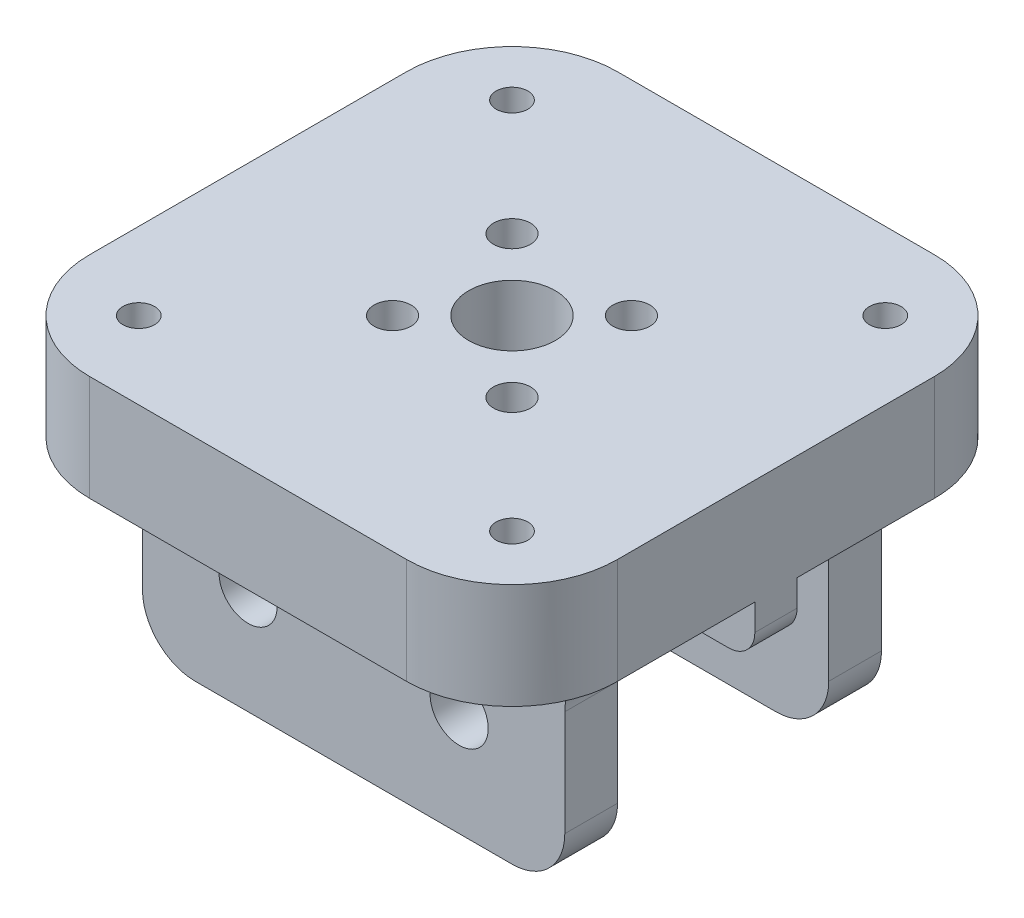
from build123d import *
from build123d.topology import SkipClean

# Parameters (mm, degrees)
SKETCH1_W                       = 50
SKETCH1_H                       = 50
BOSS_EXTRUDE1_DEPTH             = 5
BOSS_EXTRUDE3_START             = -25
SKETCH4_W                       = 4
SKETCH4_H                       = 5
BOSS_EXTRUDE3_DEPTH             = 50
CBORE_FOR_M3_SBHCS1_D           = 3.5
CBORE_FOR_M3_SBHCS1_DEPTH       = 10.76
CBORE_FOR_M3_SBHCS1_CBORE_D     = 6.7
CBORE_FOR_M3_SBHCS1_CBORE_DEPTH = 1.65
CBORE_FOR_M3_SBHCS1_TIP         = 1.051506083
CBORE_FOR_M3_SBHCS2_D           = 3
CBORE_FOR_M3_SBHCS2_DEPTH       = 10.76
CBORE_FOR_M3_SBHCS2_CBORE_D     = 6.7
CBORE_FOR_M3_SBHCS2_CBORE_DEPTH = 1.65
CBORE_FOR_M3_SBHCS2_TIP         = 0.901290929
SKETCH19_W                      = 5
SKETCH19_H                      = 20
BOSS_EXTRUDE4_DEPTH             = 20
M5_CLEARANCE_HOLE1_D            = 5.5
FILLET1_R                       = 10
FILLET2_R                       = 5
FILLET3_R                       = 5
FILLET4_R                       = 2.5
FILLET5_R                       = 2.5
SKETCH24_R                      = 4.1
CUT_EXTRUDE1_DEPTH              = 8


# Some blends are built 0.0001 mm under size
with BuildPart() as part:
    # Sketch1 → Boss-Extrude1 (new, symmetric)
    with BuildSketch(Plane(origin=(0, 0, 0), x_dir=(1, 0, 0), z_dir=(0, 1, 0))):
        Rectangle(SKETCH1_W, SKETCH1_H)
    extrude(amount=BOSS_EXTRUDE1_DEPTH, both=True)

    # Sketch4 → Boss-Extrude3 (add)
    with BuildSketch(Plane(origin=(0, 0, 0), x_dir=(0, 0, -1), z_dir=(1, 0, 0)).offset(BOSS_EXTRUDE3_START)):
        with Locations((0, -7.5)):
            Rectangle(SKETCH4_W, SKETCH4_H)
    extrude(amount=BOSS_EXTRUDE3_DEPTH)

    # CBORE for M3 SBHCS1
    with Locations(Plane(origin=(0, -5, 0), x_dir=(-1, 0, 0), z_dir=(0, -1, 0))):
        with Locations((5.656854249, -5.656854249), (-6.717514421, -6.717514421), (6.717514421, 6.717514421), (-5.656854249, 5.656854249)):
            CounterBoreHole(CBORE_FOR_M3_SBHCS1_D / 2, CBORE_FOR_M3_SBHCS1_CBORE_D / 2, CBORE_FOR_M3_SBHCS1_CBORE_DEPTH, depth=CBORE_FOR_M3_SBHCS1_DEPTH)
            with Locations((0, 0, -(CBORE_FOR_M3_SBHCS1_DEPTH + CBORE_FOR_M3_SBHCS1_TIP / 2))):  # 118° drill point
                Cone(0, CBORE_FOR_M3_SBHCS1_D / 2, CBORE_FOR_M3_SBHCS1_TIP, mode=Mode.SUBTRACT)

    # CBORE for M3 SBHCS2
    with Locations(Plane(origin=(0, -5, 0), x_dir=(-1, 0, 0), z_dir=(0, -1, 0))):
        with Locations((17.67766953, 17.67766953), (17.67766953, -17.67766953), (-17.67766953, -17.67766953), (-17.67766953, 17.67766953)):
            CounterBoreHole(CBORE_FOR_M3_SBHCS2_D / 2, CBORE_FOR_M3_SBHCS2_CBORE_D / 2, CBORE_FOR_M3_SBHCS2_CBORE_DEPTH, depth=CBORE_FOR_M3_SBHCS2_DEPTH)
            with Locations((0, 0, -(CBORE_FOR_M3_SBHCS2_DEPTH + CBORE_FOR_M3_SBHCS2_TIP / 2))):  # 118° drill point
                Cone(0, CBORE_FOR_M3_SBHCS2_D / 2, CBORE_FOR_M3_SBHCS2_TIP, mode=Mode.SUBTRACT)

    # Sketch19 → Boss-Extrude4 (add, symmetric)
    with BuildSketch(Plane(origin=(0, 0, 0), x_dir=(0, 0, -1), z_dir=(1, 0, 0))):
        with Locations((12.5, -15)):
            Rectangle(SKETCH19_W, SKETCH19_H)
    boss_extrude4 = extrude(amount=BOSS_EXTRUDE4_DEPTH, both=True)

    # Mirror1: Boss-Extrude4 across plane
    add(boss_extrude4.mirror(Plane.XY))

    # M5 Clearance Hole1 (through all)
    with Locations(Plane.XY.offset(15)):
        with Locations((10, -15)):
            m5_clearance_hole1 = Hole(M5_CLEARANCE_HOLE1_D / 2)

    # Fillet1
    fillet1_edges = [part.edges().sort_by_distance(p)[0] for p in [
        (-25, 0, 25),
        (25, 0, 25),
        (25, 0, -25),
        (-25, 0, -25),
    ]]
    fillet(fillet1_edges, radius=FILLET1_R)

    # Fillet2
    fillet2_edges = [part.edges().sort_by_distance(p)[0] for p in [
        (-20, -25, -12.5),
        (20, -25, -12.5),
        (20, -25, 12.5),
        (-20, -25, 12.5),
    ]]
    fillet(fillet2_edges, radius=FILLET2_R)

    # Fillet3
    fillet3_edges = [part.edges().sort_by_distance(p)[0] for p in [
        (-20, -5, -12.5),
        (20, -5, -12.5),
        (20, -5, 12.5),
        (-20, -5, 12.5),
    ]]
    fillet(fillet3_edges, radius=FILLET3_R - 0.0001)  # a hair under: the kernel refuses the full size

    # Fillet4
    fillet4_edges = [part.edges().sort_by_distance(p)[0] for p in [
        (-25, -10, 0),
        (25, -10, 0),
    ]]
    fillet(fillet4_edges, radius=FILLET4_R)

    # Mirror2: M5 Clearance Hole1 across plane
    add(m5_clearance_hole1.mirror(Plane(origin=(0, 0, 0), x_dir=(0, 0, 1), z_dir=(1, 0, 0))), mode=Mode.SUBTRACT)

    # Fillet5
    # the kernel refuses this fillet: 2.5 mm, written as the material it adds along each edge
    with BuildSketch(Plane(origin=(31.2499, -5, -15), x_dir=(0, 0, -1), z_dir=(-1, 0, 0))) as fillet5_piece_1_section:
        with BuildLine():
            CenterArc((FILLET5_R, FILLET5_R), FILLET5_R, 180, 90)
            Line((0, FILLET5_R), (0, 0))
            Line((0, 0), (FILLET5_R, 0))
        make_face()
    fillet5_piece_1 = extrude(amount=17.809126924, mode=Mode.PRIVATE)
    fillet5_piece_1 = fillet5_piece_1 & Plane(origin=(15, -5.443084519, -15), x_dir=(1, 0, 0), z_dir=(0, 1, 0)) * Cylinder(10, 46, mode=Mode.PRIVATE)
    fillet5_piece_1 = fillet5_piece_1 - Plane(origin=(17.67766953, -5.443084519, -17.67766953), x_dir=(-1, 0, 0), z_dir=(0, -1, 0)) * Cylinder(3.35, 46, mode=Mode.PRIVATE)
    fillet5_piece_1 = fillet5_piece_1 - Plane(origin=(24.9999, -9.9999, -15.600375786), x_dir=(0, 1, 0), z_dir=(0, 0, -1)) * Cylinder(4.9999, 46, mode=Mode.PRIVATE)
    add(fillet5_piece_1)
    with BuildSketch(Plane(origin=(-21.914565984, -5, -15), x_dir=(0, 0, -1), z_dir=(1, 0, 0))) as fillet5_piece_2_section:
        with BuildLine():
            CenterArc((FILLET5_R, -FILLET5_R), FILLET5_R, 90, 90)
            Line((0, -FILLET5_R), (0, 0))
            Line((0, 0), (FILLET5_R, 0))
        make_face()
    fillet5_piece_2 = extrude(amount=43.829131967, mode=Mode.PRIVATE)
    fillet5_piece_2 = fillet5_piece_2 - Plane(origin=(-24.9999, -9.9999, -15.47958938), x_dir=(0, 1, 0), z_dir=(0, 0, -1)) * Cylinder(4.9999, 98, mode=Mode.PRIVATE)
    fillet5_piece_2 = fillet5_piece_2 - Plane(origin=(-17.67766953, -5.581152755, -17.67766953), x_dir=(-1, 0, 0), z_dir=(0, -1, 0)) * Cylinder(3.35, 98, mode=Mode.PRIVATE)
    fillet5_piece_2 = fillet5_piece_2 - Plane(origin=(17.67766953, -5.581152755, -17.67766953), x_dir=(-1, 0, 0), z_dir=(0, -1, 0)) * Cylinder(3.35, 98, mode=Mode.PRIVATE)
    fillet5_piece_2 = fillet5_piece_2 - Plane(origin=(24.9999, -9.9999, -15.47958938), x_dir=(0, 1, 0), z_dir=(0, 0, -1)) * Cylinder(4.9999, 98, mode=Mode.PRIVATE)
    add(fillet5_piece_2)
    with BuildSketch(Plane(origin=(-13.440773076, -5, -15), x_dir=(0, 0, -1), z_dir=(-1, 0, 0))) as fillet5_piece_3_section:
        with BuildLine():
            CenterArc((FILLET5_R, FILLET5_R), FILLET5_R, 180, 90)
            Line((0, FILLET5_R), (0, 0))
            Line((0, 0), (FILLET5_R, 0))
        make_face()
    fillet5_piece_3 = extrude(amount=17.809126924, mode=Mode.PRIVATE)
    fillet5_piece_3 = fillet5_piece_3 & Plane(origin=(-15, -5.616758161, -15), x_dir=(-1, 0, 0), z_dir=(0, -1, 0)) * Cylinder(10, 46, mode=Mode.PRIVATE)
    fillet5_piece_3 = fillet5_piece_3 - Plane(origin=(-24.9999, -9.9999, -15.466172453), x_dir=(0, 1, 0), z_dir=(0, 0, -1)) * Cylinder(4.9999, 46, mode=Mode.PRIVATE)
    fillet5_piece_3 = fillet5_piece_3 - Plane(origin=(-17.67766953, -5.616758161, -17.67766953), x_dir=(-1, 0, 0), z_dir=(0, -1, 0)) * Cylinder(3.35, 46, mode=Mode.PRIVATE)
    add(fillet5_piece_3)
    with BuildSketch(Plane(origin=(31.2499, -5, 15), x_dir=(0, 0, 1), z_dir=(-1, 0, 0))) as fillet5_piece_4_section:
        with BuildLine():
            CenterArc((FILLET5_R, -FILLET5_R), FILLET5_R, 90, 90)
            Line((0, -FILLET5_R), (0, 0))
            Line((0, 0), (FILLET5_R, 0))
        make_face()
    fillet5_piece_4 = extrude(amount=17.809126924, mode=Mode.PRIVATE)
    fillet5_piece_4 = fillet5_piece_4 & Plane(origin=(15, -5.443086439, 15), x_dir=(0, 0, 1), z_dir=(0, 1, 0)) * Cylinder(10, 46, mode=Mode.PRIVATE)
    fillet5_piece_4 = fillet5_piece_4 - Plane(origin=(24.9999, -9.9999, 15.600377701), x_dir=(0, 1, 0), z_dir=(0, 0, 1)) * Cylinder(4.9999, 46, mode=Mode.PRIVATE)
    fillet5_piece_4 = fillet5_piece_4 - Plane(origin=(17.67766953, -5.443086439, 17.67766953), x_dir=(-1, 0, 0), z_dir=(0, -1, 0)) * Cylinder(3.35, 46, mode=Mode.PRIVATE)
    add(fillet5_piece_4)
    with BuildSketch(Plane(origin=(-21.914565984, -5, 15), x_dir=(0, 0, 1), z_dir=(1, 0, 0))) as fillet5_piece_5_section:
        with BuildLine():
            CenterArc((FILLET5_R, FILLET5_R), FILLET5_R, 180, 90)
            Line((0, FILLET5_R), (0, 0))
            Line((0, 0), (FILLET5_R, 0))
        make_face()
    fillet5_piece_5 = extrude(amount=43.829131967, mode=Mode.PRIVATE)
    fillet5_piece_5 = fillet5_piece_5 - Plane(origin=(24.9999, -9.9999, 15.479588149), x_dir=(0, 1, 0), z_dir=(0, 0, 1)) * Cylinder(4.9999, 98, mode=Mode.PRIVATE)
    fillet5_piece_5 = fillet5_piece_5 - Plane(origin=(17.67766953, -5.581152089, 17.67766953), x_dir=(-1, 0, 0), z_dir=(0, -1, 0)) * Cylinder(3.35, 98, mode=Mode.PRIVATE)
    fillet5_piece_5 = fillet5_piece_5 - Plane(origin=(-17.67766953, -5.581152089, 17.67766953), x_dir=(-1, 0, 0), z_dir=(0, -1, 0)) * Cylinder(3.35, 98, mode=Mode.PRIVATE)
    fillet5_piece_5 = fillet5_piece_5 - Plane(origin=(-24.9999, -9.9999, 15.479588149), x_dir=(1, 0, 0), z_dir=(0, 0, 1)) * Cylinder(4.9999, 98, mode=Mode.PRIVATE)
    add(fillet5_piece_5)
    with BuildSketch(Plane(origin=(-13.440773076, -5, 15), x_dir=(0, 0, 1), z_dir=(-1, 0, 0))) as fillet5_piece_6_section:
        with BuildLine():
            CenterArc((FILLET5_R, -FILLET5_R), FILLET5_R, 90, 90)
            Line((0, -FILLET5_R), (0, 0))
            Line((0, 0), (FILLET5_R, 0))
        make_face()
    fillet5_piece_6 = extrude(amount=17.809126924, mode=Mode.PRIVATE)
    fillet5_piece_6 = fillet5_piece_6 & Plane(origin=(-15, -5.616758645, 15), x_dir=(0, 0, 1), z_dir=(0, -1, 0)) * Cylinder(10, 46, mode=Mode.PRIVATE)
    fillet5_piece_6 = fillet5_piece_6 - Plane(origin=(-17.67766953, -5.616758645, 17.67766953), x_dir=(-1, 0, 0), z_dir=(0, -1, 0)) * Cylinder(3.35, 46, mode=Mode.PRIVATE)
    fillet5_piece_6 = fillet5_piece_6 - Plane(origin=(-24.9999, -9.9999, 15.466173234), x_dir=(1, 0, 0), z_dir=(0, 0, 1)) * Cylinder(4.9999, 46, mode=Mode.PRIVATE)
    add(fillet5_piece_6)

    # Sketch24 → Cut-Extrude1 (cut)
    with SkipClean():  # the faces are left unmerged after this step: merging them gives an invalid solid
        with BuildSketch(Plane(origin=(0, 5, 0), x_dir=(1, 0, 0), z_dir=(0, 1, 0))):
            with Locations(Location((0, 0, 0), (0, 0, 270))):
                Circle(SKETCH24_R)
        extrude(amount=-CUT_EXTRUDE1_DEPTH, mode=Mode.SUBTRACT)
    add(part.part.scale(1), mode=Mode.REPLACE)  # the faces are merged on a copy


solid = part.part
